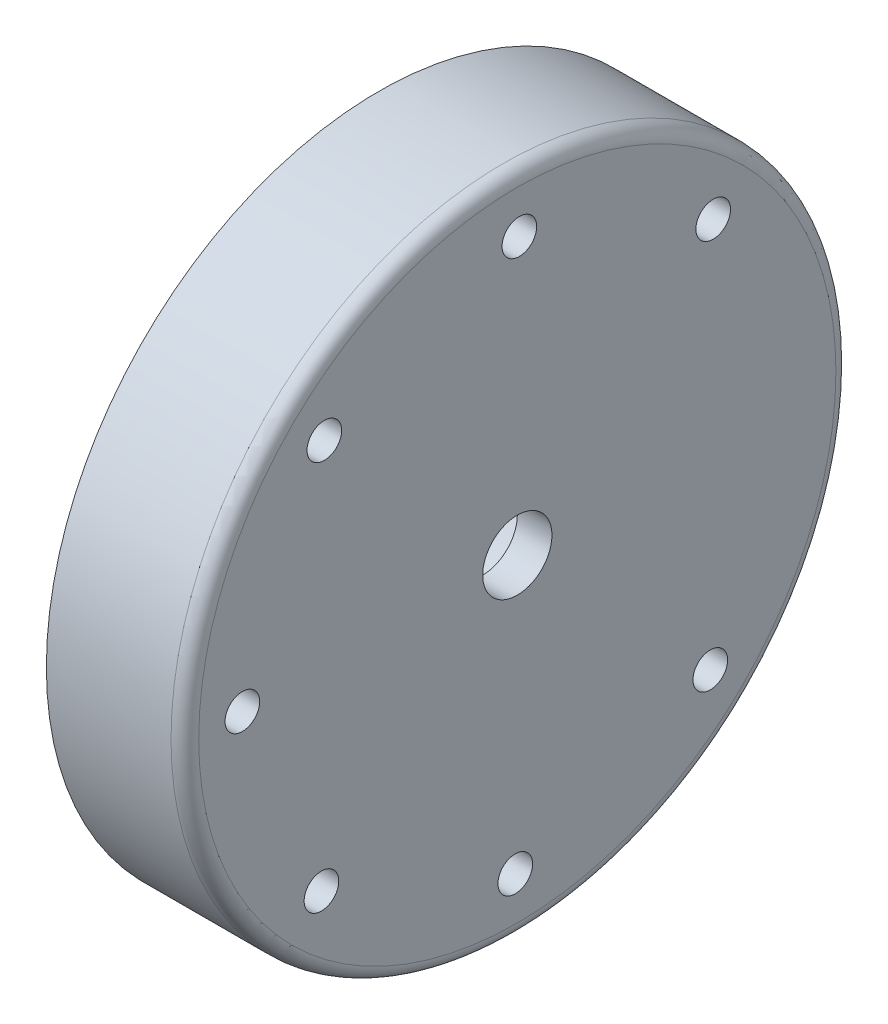
from build123d import *

# Parameters (mm, degrees)
SKETCH1_R           = 60.96
BOSS_EXTRUDE1_DEPTH = 25.4
FILLET1_R           = 2.54
SKETCH2_R           = 4.05
CUT_EXTRUDE1_DEPTH  = 6.35
SKETCH4_R           = 25.019
CUT_EXTRUDE3_DEPTH  = 90.874374546
SKETCH5_R           = 3.175
CUT_EXTRUDE4_DEPTH  = 90.874374546
CIRPATTERN2_COUNT   = 8
SKETCH6_R           = 25.019
SKETCH6_R_2         = 6.35
BOSS_EXTRUDE2_DEPTH = 6.35


with BuildPart() as part:
    # Sketch1 → Boss-Extrude1 (new body)
    with BuildSketch(Plane(origin=(0, 0, 0), x_dir=(0, 0, -1), z_dir=(1, 0, 0))):
        Circle(SKETCH1_R)
    extrude(amount=BOSS_EXTRUDE1_DEPTH)

    # Fillet1
    fillet1_edges = [part.edges().sort_by_distance(p)[0] for p in [
        (25.4, 0, 60.96),
    ]]
    fillet(fillet1_edges, radius=FILLET1_R)

    # Sketch2 → Cut-Extrude1 (cut)
    with BuildSketch(Plane(origin=(25.4, 0, 0), x_dir=(0, 0, -1), z_dir=(1, 0, 0))):
        Circle(SKETCH2_R)
    extrude(amount=-CUT_EXTRUDE1_DEPTH, mode=Mode.SUBTRACT)

    # Sketch4 → Cut-Extrude3 (cut, through all)
    with BuildSketch(Plane(origin=(25.4, 0, 0), x_dir=(0, 0, -1), z_dir=(1, 0, 0))):
        Circle(SKETCH4_R)
    extrude(amount=-CUT_EXTRUDE3_DEPTH, mode=Mode.SUBTRACT)

    # Sketch5 → Cut-Extrude4 (cut, through all)
    with BuildSketch(Plane.ZY):
        with Locations((-35.91734849, 35.383889532)):
            Circle(SKETCH5_R)
    cut_extrude4 = extrude(amount=-CUT_EXTRUDE4_DEPTH, mode=Mode.SUBTRACT)

    # CirPattern2: Cut-Extrude4 ×8 about axis, 1 skipped
    cirpattern2_axis = Axis((25.4, 0, 0), (1, 0, 0))
    add([cut_extrude4.rotate(cirpattern2_axis, i * 360 / CIRPATTERN2_COUNT) for i in range(1, CIRPATTERN2_COUNT) if i not in (7,)], mode=Mode.SUBTRACT)

    # Sketch6 → Boss-Extrude2 (add)
    with BuildSketch(Plane(origin=(25.4, 0, 0), x_dir=(0, 0, -1), z_dir=(1, 0, 0))):
        Circle(SKETCH6_R)
        Circle(SKETCH6_R_2, mode=Mode.SUBTRACT)
    extrude(amount=-BOSS_EXTRUDE2_DEPTH)


solid = part.part
